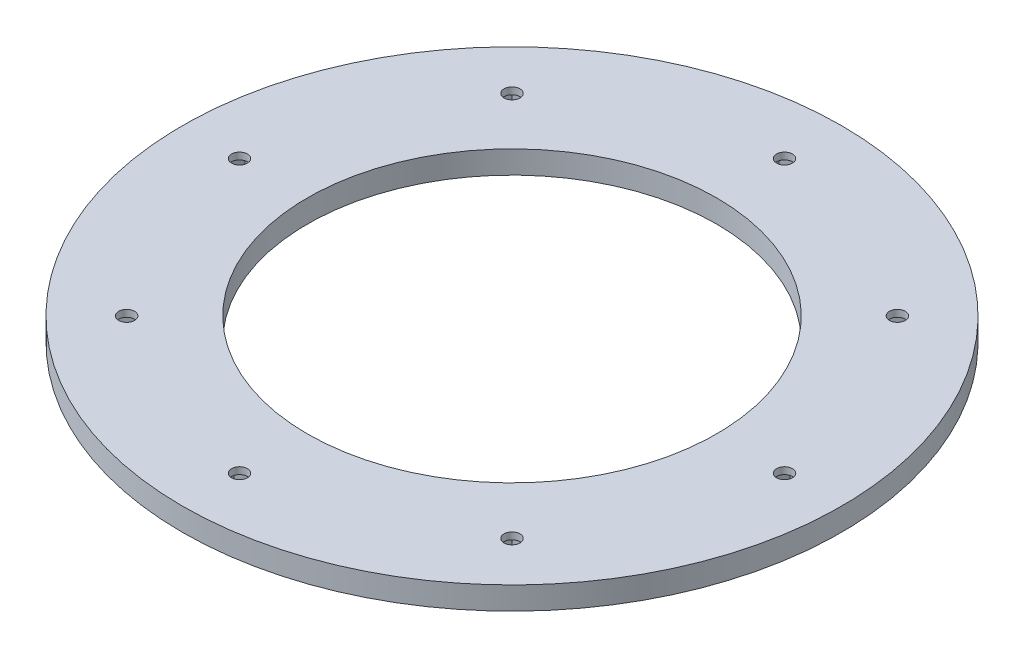
from build123d import *

# Parameters (mm, degrees)
SZKIC1_R                         = 72.5
DODANIE_WYCI_GNI_CIE1_DEPTH      = 5
DODANIE_WYCI_GNI_CIE2_START      = 5
SZKIC1_3_R                       = 65
SZKIC1_3_R_2                     = 54.5
DODANIE_WYCI_GNI_CIE2_DEPTH      = 8
DODANIE_WYCI_GNI_CIE3_START      = 13
SZKIC1_4_R                       = 54.5
DODANIE_WYCI_GNI_CIE3_DEPTH      = 30
DODANIE_WYCI_GNI_CIE4_START      = 43
SZKIC2_W                         = 34
SZKIC2_H                         = 88
DODANIE_WYCI_GNI_CIE4_DEPTH      = 93
SZKIC3_R                         = 45
WYTNIJ_WYCI_GNI_CIE1_DEPTH       = 10
DODANIE_WYCI_GNI_CIE5_START      = 10
SZKIC4_R                         = 3
DODANIE_WYCI_GNI_CIE5_DEPTH      = 13
ZAAWANSOWANYOTW_R1_OUTLINE_R     = 1.75
ZAAWANSOWANYOTW_R1_DEPTH         = 13
ZAAWANSOWANYOTW_R1_START         = 10
ZAAWANSOWANYOTW_R1_2_OUTLINE_R   = 3
ZAAWANSOWANYOTW_R1_2_OUTLINE_R_2 = 1.75
ZAAWANSOWANYOTW_R1_2_DEPTH       = 3
SZKIC7_R                         = 4.25
WYTNIJ_WYCI_GNI_CIE2_START       = -13
WYTNIJ_WYCI_GNI_CIE2_DEPTH       = 3.5
PRZECI_CIE1_START                = 5
PRZECI_CIE1_OUTLINE_R            = 1.75
PRZECI_CIE1_DEPTH                = 131
PRZECI_CIE1_START_2              = -3
PRZECI_CIE1_2_OUTLINE_R          = 3
PRZECI_CIE1_2_DEPTH              = 8


# Read off the part's stored shape, not the designer's step: ZaawansowanyOtwór1, Przecięcie1
with BuildPart() as part:
    # Szkic1 → Dodanie-wyciągnięcie1 (new body)
    with BuildSketch(Plane(origin=(0, 0, 0), x_dir=(1, 0, 0), z_dir=(0, 1, 0))):
        with Locations(Location((0, 0, 0), (0, 0, 270))):
            Circle(SZKIC1_R)
    extrude(amount=DODANIE_WYCI_GNI_CIE1_DEPTH)

    # Szkic1<3> → Dodanie-wyciągnięcie2 (add)
    with BuildSketch(Plane(origin=(0, 0, 0), x_dir=(1, 0, 0), z_dir=(0, 1, 0)).offset(DODANIE_WYCI_GNI_CIE2_START)):
        with Locations(Location((0, 0, 0), (0, 0, 270))):
            Circle(SZKIC1_3_R)
        Circle(SZKIC1_3_R_2)
    extrude(amount=DODANIE_WYCI_GNI_CIE2_DEPTH)

    # Szkic1<4> → Dodanie-wyciągnięcie3 (add)
    with BuildSketch(Plane(origin=(0, 0, 0), x_dir=(1, 0, 0), z_dir=(0, 1, 0)).offset(DODANIE_WYCI_GNI_CIE3_START)):
        with Locations(Location((0, 0, 0), (0, 0, 270))):
            Circle(SZKIC1_4_R)
    extrude(amount=DODANIE_WYCI_GNI_CIE3_DEPTH)

    # Szkic2 → Dodanie-wyciągnięcie4 (add)
    with BuildSketch(Plane(origin=(0, 0, 0), x_dir=(1, 0, 0), z_dir=(0, 1, 0)).offset(DODANIE_WYCI_GNI_CIE4_START)):
        with Locations((-44.5, -12.5)):
            Rectangle(SZKIC2_W, SZKIC2_H)
        with Locations((44.5, -12.5)):
            Rectangle(SZKIC2_W, SZKIC2_H)
    extrude(amount=DODANIE_WYCI_GNI_CIE4_DEPTH)

    # Szkic3 → Wytnij-wyciągnięcie1 (cut)
    with BuildSketch(Plane(origin=(0, 0, 0), x_dir=(1, 0, 0), z_dir=(0, 1, 0))):
        with Locations(Location((0, 0, 0), (0, 0, 270))):
            Circle(SZKIC3_R)
    extrude(amount=WYTNIJ_WYCI_GNI_CIE1_DEPTH, mode=Mode.SUBTRACT)

    # Szkic4 → Dodanie-wyciągnięcie5 (add)
    with BuildSketch(Plane(origin=(0, 0, 0), x_dir=(1, 0, 0), z_dir=(0, 1, 0)).offset(DODANIE_WYCI_GNI_CIE5_START)):
        with Locations(Location((0, 0, 0), (0, 0, 270))):
            Circle(SZKIC4_R)
    extrude(amount=-DODANIE_WYCI_GNI_CIE5_DEPTH)

    # ZaawansowanyOtwór1 outline → ZaawansowanyOtwór1 (cut)
    with BuildSketch(Plane(origin=(0, 0, 0), x_dir=(1, 0, 0), z_dir=(0, 1, 0))):
        with Locations((-42.391051532, 42.391051532)):
            Circle(ZAAWANSOWANYOTW_R1_OUTLINE_R)
        with Locations((-59.95, 0)):
            Circle(ZAAWANSOWANYOTW_R1_OUTLINE_R)
        with Locations((-42.391051532, -42.391051532)):
            Circle(ZAAWANSOWANYOTW_R1_OUTLINE_R)
        with Locations((0, -59.95)):
            Circle(ZAAWANSOWANYOTW_R1_OUTLINE_R)
        with Locations((42.391051532, -42.391051532)):
            Circle(ZAAWANSOWANYOTW_R1_OUTLINE_R)
        with Locations((59.95, 0)):
            Circle(ZAAWANSOWANYOTW_R1_OUTLINE_R)
        with Locations((42.391051532, 42.391051532)):
            Circle(ZAAWANSOWANYOTW_R1_OUTLINE_R)
        with Locations((0, 59.95)):
            Circle(ZAAWANSOWANYOTW_R1_OUTLINE_R)
    extrude(amount=ZAAWANSOWANYOTW_R1_DEPTH, mode=Mode.SUBTRACT)

    # ZaawansowanyOtw_r1 2 outline → ZaawansowanyOtw_r1 2 (cut)
    # profile 1 of 8: a face of its own
    with BuildSketch(Plane(origin=(0, 0, 0), x_dir=(1, 0, 0), z_dir=(0, 1, 0)).offset(ZAAWANSOWANYOTW_R1_START)):
        with Locations((-42.391051532, 42.391051532)):
            Circle(ZAAWANSOWANYOTW_R1_2_OUTLINE_R)
        with Locations((-42.391051532, 42.391051532)):
            Circle(ZAAWANSOWANYOTW_R1_2_OUTLINE_R_2, mode=Mode.SUBTRACT)
    # profile 2 of 8: a face of its own
    with BuildSketch(Plane(origin=(0, 0, 0), x_dir=(1, 0, 0), z_dir=(0, 1, 0)).offset(ZAAWANSOWANYOTW_R1_START)):
        with Locations((-59.95, 0)):
            Circle(ZAAWANSOWANYOTW_R1_2_OUTLINE_R)
        with Locations((-59.95, 0)):
            Circle(ZAAWANSOWANYOTW_R1_2_OUTLINE_R_2, mode=Mode.SUBTRACT)
    # profile 3 of 8: a face of its own
    with BuildSketch(Plane(origin=(0, 0, 0), x_dir=(1, 0, 0), z_dir=(0, 1, 0)).offset(ZAAWANSOWANYOTW_R1_START)):
        with Locations((-42.391051532, -42.391051532)):
            Circle(ZAAWANSOWANYOTW_R1_2_OUTLINE_R)
        with Locations((-42.391051532, -42.391051532)):
            Circle(ZAAWANSOWANYOTW_R1_2_OUTLINE_R_2, mode=Mode.SUBTRACT)
    # profile 4 of 8: a face of its own
    with BuildSketch(Plane(origin=(0, 0, 0), x_dir=(1, 0, 0), z_dir=(0, 1, 0)).offset(ZAAWANSOWANYOTW_R1_START)):
        with Locations((0, -59.95)):
            Circle(ZAAWANSOWANYOTW_R1_2_OUTLINE_R)
        with Locations((0, -59.95)):
            Circle(ZAAWANSOWANYOTW_R1_2_OUTLINE_R_2, mode=Mode.SUBTRACT)
    # profile 5 of 8: a face of its own
    with BuildSketch(Plane(origin=(0, 0, 0), x_dir=(1, 0, 0), z_dir=(0, 1, 0)).offset(ZAAWANSOWANYOTW_R1_START)):
        with Locations((42.391051532, -42.391051532)):
            Circle(ZAAWANSOWANYOTW_R1_2_OUTLINE_R)
        with Locations((42.391051532, -42.391051532)):
            Circle(ZAAWANSOWANYOTW_R1_2_OUTLINE_R_2, mode=Mode.SUBTRACT)
    # profile 6 of 8: a face of its own
    with BuildSketch(Plane(origin=(0, 0, 0), x_dir=(1, 0, 0), z_dir=(0, 1, 0)).offset(ZAAWANSOWANYOTW_R1_START)):
        with Locations((59.95, 0)):
            Circle(ZAAWANSOWANYOTW_R1_2_OUTLINE_R)
        with Locations((59.95, 0)):
            Circle(ZAAWANSOWANYOTW_R1_2_OUTLINE_R_2, mode=Mode.SUBTRACT)
    # profile 7 of 8: a face of its own
    with BuildSketch(Plane(origin=(0, 0, 0), x_dir=(1, 0, 0), z_dir=(0, 1, 0)).offset(ZAAWANSOWANYOTW_R1_START)):
        with Locations((42.391051532, 42.391051532)):
            Circle(ZAAWANSOWANYOTW_R1_2_OUTLINE_R)
        with Locations((42.391051532, 42.391051532)):
            Circle(ZAAWANSOWANYOTW_R1_2_OUTLINE_R_2, mode=Mode.SUBTRACT)
    # profile 8 of 8: a face of its own
    with BuildSketch(Plane(origin=(0, 0, 0), x_dir=(1, 0, 0), z_dir=(0, 1, 0)).offset(ZAAWANSOWANYOTW_R1_START)):
        with Locations((0, 59.95)):
            Circle(ZAAWANSOWANYOTW_R1_2_OUTLINE_R)
        with Locations((0, 59.95)):
            Circle(ZAAWANSOWANYOTW_R1_2_OUTLINE_R_2, mode=Mode.SUBTRACT)
    extrude(amount=ZAAWANSOWANYOTW_R1_2_DEPTH, mode=Mode.SUBTRACT)

    # Szkic7 → Wycięcie-obrót1 (revolve, cut)
    with BuildSketch(Plane(origin=(0, 0, 0), x_dir=(0, 0, -1), z_dir=(1, 0, 0)), mode=Mode.PRIVATE) as wyci_cie_obr_t1_sk:
        with Locations((51, -1.7)):
            Circle(SZKIC7_R)
    revolve(wyci_cie_obr_t1_sk.sketch.rotate(Axis((0, 0, 0), (0, -1, 0)), 305.308707607), axis=Axis((0, 0, 0), (0, -1, 0)), mode=Mode.SUBTRACT)

    # Szkic5 → Wytnij-wyciągnięcie2 (cut)
    with BuildSketch(Plane(origin=(0, 13, 0), x_dir=(1, 0, 0), z_dir=(0, 1, 0)).offset(WYTNIJ_WYCI_GNI_CIE2_START)):
        Polygon((43.227855306, 39.268057332), (45.514045733, 41.554247758), (44.677241959, 44.677241959), (41.554247758, 45.514045733), (39.268057332, 43.227855306), (40.104861106, 40.104861106), align=None)
        Polygon((-2.8, 61.566580754), (-2.8, 58.333419246), (0, 56.716838493), (2.8, 58.333419246), (2.8, 61.566580754), (0, 63.183161507), align=None)
        Polygon((58.333419246, -2.8), (61.566580754, -2.8), (63.183161507, 0), (61.566580754, 2.8), (58.333419246, 2.8), (56.716838493, 0), align=None)
        Polygon((39.268057332, -43.227855306), (41.554247758, -45.514045733), (44.677241959, -44.677241959), (45.514045733, -41.554247758), (43.227855306, -39.268057332), (40.104861106, -40.104861106), align=None)
        Polygon((-2.8, -58.333419246), (-2.8, -61.566580754), (0, -63.183161507), (2.8, -61.566580754), (2.8, -58.333419246), (0, -56.716838493), align=None)
        Polygon((-43.227855306, -39.268057332), (-45.514045733, -41.554247758), (-44.677241959, -44.677241959), (-41.554247758, -45.514045733), (-39.268057332, -43.227855306), (-40.104861106, -40.104861106), align=None)
        Polygon((-58.333419246, 2.8), (-61.566580754, 2.8), (-63.183161507, 0), (-61.566580754, -2.8), (-58.333419246, -2.8), (-56.716838493, 0), align=None)
        Polygon((-39.268057332, 43.227855306), (-41.554247758, 45.514045733), (-44.677241959, 44.677241959), (-45.514045733, 41.554247758), (-43.227855306, 39.268057332), (-40.104861106, 40.104861106), align=None)
    extrude(amount=WYTNIJ_WYCI_GNI_CIE2_DEPTH, mode=Mode.SUBTRACT)

    # Przecięcie1 outline → Przecięcie1 (cut)
    with BuildSketch(Plane(origin=(0, 0, 0), x_dir=(1, 0, 0), z_dir=(0, 1, 0)).offset(PRZECI_CIE1_START)):
        with BuildLine():
            ThreePointArc((61.5, -21.041625412), (65, 0), (61.5, 21.041625413))
            Line((61.5, 21.041625413), (61.5, 31.5))
            Line((61.5, 31.5), (56.857277459, 31.5))
            ThreePointArc((56.857277459, 31.5), (0, 65), (-56.857277459, 31.5))
            Line((-56.857277459, 31.5), (-61.5, 31.5))
            Line((-61.5, 31.5), (-61.5, 21.041625412))
            ThreePointArc((-61.5, 21.041625412), (-65, 0), (-61.5, -21.041625412))
            Line((-61.5, -21.041625412), (-61.5, -56.5))
            Line((-61.5, -56.5), (-32.136427928, -56.5))
            ThreePointArc((-32.136427928, -56.5), (0, -65), (32.136427928, -56.5))
            Line((32.136427928, -56.5), (61.5, -56.5))
            Line((61.5, -56.5), (61.5, -21.041625412))
        make_face()
        with BuildLine():
            ThreePointArc((61.5, 0.81240384), (61.7, 0), (61.5, -0.81240384))
            Line((61.5, -0.81240384), (61.5, 0.81240384))
        make_face(mode=Mode.SUBTRACT)
        with Locations((0, -59.95)):
            Circle(PRZECI_CIE1_OUTLINE_R, mode=Mode.SUBTRACT)
        with Locations((42.391051532, 42.391051532)):
            Circle(PRZECI_CIE1_OUTLINE_R, mode=Mode.SUBTRACT)
        with Locations((-42.391051532, 42.391051532)):
            Circle(PRZECI_CIE1_OUTLINE_R, mode=Mode.SUBTRACT)
        with Locations((0, 59.95)):
            Circle(PRZECI_CIE1_OUTLINE_R, mode=Mode.SUBTRACT)
        with BuildLine():
            ThreePointArc((-61.5, -0.81240384), (-61.7, 0), (-61.5, 0.81240384))
            Line((-61.5, 0.81240384), (-61.5, -0.81240384))
        make_face(mode=Mode.SUBTRACT)
    extrude(amount=PRZECI_CIE1_DEPTH, mode=Mode.SUBTRACT)

    # Przeci_cie1 2 outline → Przeci_cie1 2 (cut)
    with BuildSketch(Plane(origin=(0, 0, 0), x_dir=(1, 0, 0), z_dir=(0, 1, 0)).offset(PRZECI_CIE1_START_2)):
        Circle(PRZECI_CIE1_2_OUTLINE_R)
    extrude(amount=PRZECI_CIE1_2_DEPTH, mode=Mode.SUBTRACT)


solid = part.part
